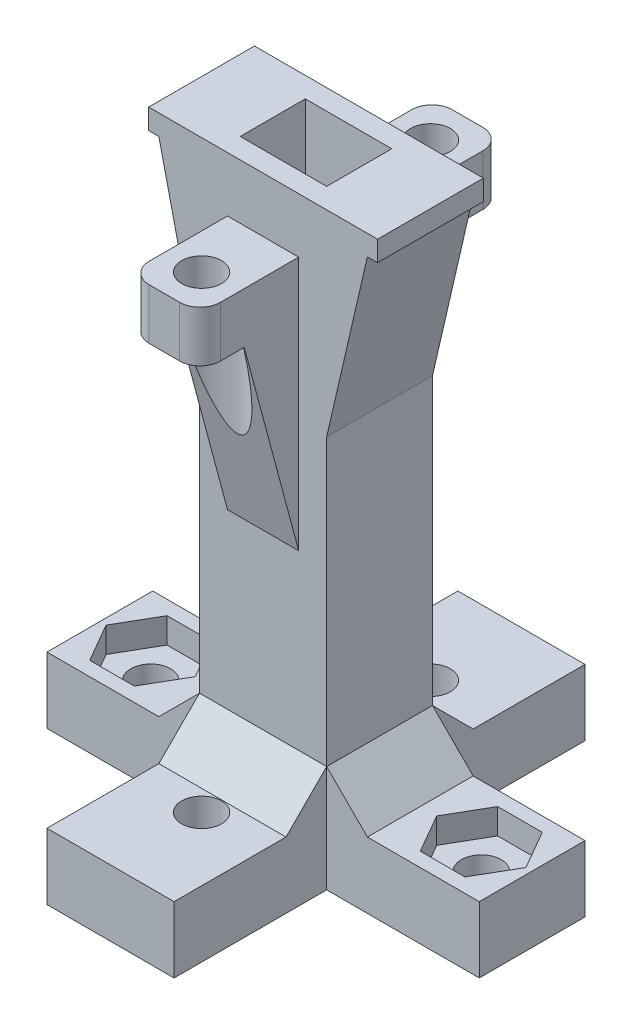
from build123d import *
from OCP.BRepFilletAPI import BRepFilletAPI_MakeChamfer

# Parameters (mm, degrees)
SKETCH1_W           = 15.875
SKETCH1_H           = 13.208
BOSS_EXTRUDE1_DEPTH = 73.533
SHELL1_T            = -2.54
SKETCH3_W           = 8.89
SKETCH3_H           = 6.35
BOSS_EXTRUDE2_DEPTH = 12.319
SKETCH4_W           = 8.89
SKETCH4_H           = 6.35
BOSS_EXTRUDE3_DEPTH = 12.319
SKETCH5_W           = 13.208
SKETCH5_H           = 8.255
BOSS_EXTRUDE4_DEPTH = 19.05
SKETCH6_W           = 15.875
SKETCH6_H           = 8.255
BOSS_EXTRUDE5_DEPTH = 19.05
SKETCH7_W           = 13.208
SKETCH7_H           = 8.255
BOSS_EXTRUDE6_DEPTH = 19.05
SKETCH8_W           = 15.875
SKETCH8_H           = 8.255
BOSS_EXTRUDE7_DEPTH = 19.05
SKETCH9_R           = 2.4892
CUT_EXTRUDE1_DEPTH  = 83.847766424
CUT_EXTRUDE2_REACH  = 84.848
SKETCH11_R          = 2.4892
FILLET3_R           = 2.54
CHAMFER2_SIZE       = 25.4
CHAMFER2_SIZE_2     = 6.805909488
SKETCH12_R          = 4.445
CUT_EXTRUDE3_DEPTH  = 52.07
SKETCH13_W          = 28.575
SKETCH13_H          = 13.208
SKETCH13_W_2        = 10.795
SKETCH13_H_2        = 8.128
BOSS_EXTRUDE8_DEPTH = 2.54
CHAMFER3_SIZE       = 5.08
CHAMFER3_SIZE2      = 22.003897441
CHAMFER4_SIZE       = 5.08
CHAMFER5_SIZE       = 5.08
CUT_EXTRUDE4_DEPTH  = 3.175
CUT_EXTRUDE5_DEPTH  = 3.175


# Some blends are built 0.0001 mm under size
with BuildPart() as part:
    # Sketch1 → Boss-Extrude1 (new body)
    with BuildSketch(Plane(origin=(0, 0, 0), x_dir=(1, 0, 0), z_dir=(0, 1, 0))):
        with Locations((0, 1.3335)):
            Rectangle(SKETCH1_W, SKETCH1_H)
    extrude(amount=BOSS_EXTRUDE1_DEPTH)

    # Shell1
    shell1_openings = [part.faces().sort_by_distance(p)[0] for p in [
        (0, 73.533, -1.3335),
        (0, 0, -1.3335),
    ]]
    offset(amount=SHELL1_T, openings=shell1_openings, kind=Kind.INTERSECTION)

    # Sketch3 → Boss-Extrude2 (add)
    with BuildSketch(Plane(origin=(0, 0, -7.9375), x_dir=(-1, 0, 0), z_dir=(0, 0, -1))):
        with Locations((0, 63.5)):
            Rectangle(SKETCH3_W, SKETCH3_H)
    extrude(amount=BOSS_EXTRUDE2_DEPTH)

    # Sketch4 → Boss-Extrude3 (add)
    with BuildSketch(Plane.XY.offset(5.2705)):
        with Locations((0, 63.5)):
            Rectangle(SKETCH4_W, SKETCH4_H)
    extrude(amount=BOSS_EXTRUDE3_DEPTH)

    # Sketch5 → Boss-Extrude4 (add)
    with BuildSketch(Plane.ZY.offset(7.9375)):
        with Locations((-1.3335, 4.1275)):
            Rectangle(SKETCH5_W, SKETCH5_H)
    extrude(amount=BOSS_EXTRUDE4_DEPTH)

    # Sketch6 → Boss-Extrude5 (add)
    with BuildSketch(Plane(origin=(0, 0, -7.9375), x_dir=(-1, 0, 0), z_dir=(0, 0, -1))):
        with Locations((0, 4.1275)):
            Rectangle(SKETCH6_W, SKETCH6_H)
    extrude(amount=BOSS_EXTRUDE5_DEPTH)

    # Sketch7 → Boss-Extrude6 (add)
    with BuildSketch(Plane(origin=(7.9375, 0, 0), x_dir=(0, 0, -1), z_dir=(1, 0, 0))):
        with Locations((1.3335, 4.1275)):
            Rectangle(SKETCH7_W, SKETCH7_H)
    extrude(amount=BOSS_EXTRUDE6_DEPTH)

    # Sketch8 → Boss-Extrude7 (add)
    with BuildSketch(Plane.XY.offset(5.2705)):
        with Locations((0, 4.1275)):
            Rectangle(SKETCH8_W, SKETCH8_H)
    extrude(amount=BOSS_EXTRUDE7_DEPTH)

    # Sketch9 → Cut-Extrude1 (cut, through all)
    with BuildSketch(Plane(origin=(0, 73.533, 0), x_dir=(1, 0, 0), z_dir=(0, 1, 0))):
        with Locations((0, 15.621)):
            Circle(SKETCH9_R)
        with Locations((0, -12.954)):
            Circle(SKETCH9_R)
    extrude(amount=-CUT_EXTRUDE1_DEPTH, mode=Mode.SUBTRACT)

    # Sketch11 → Cut-Extrude2 (cut, up to next)
    with BuildSketch(Plane(origin=(0, 0, 0), x_dir=(-1, 0, 0), z_dir=(0, -1, 0)), mode=Mode.PRIVATE) as cut_extrude2_sk1:
        with Locations(Location((20.6375, 1.3335, 0), (0, 0, 90))):
            Circle(SKETCH11_R)
    cut_extrude2_tool1 = extrude(cut_extrude2_sk1.sketch, amount=-CUT_EXTRUDE2_REACH, mode=Mode.PRIVATE) & part.part
    # Sketch11 → Cut-Extrude2 (cut, up to next)
    with BuildSketch(Plane(origin=(0, 0, 0), x_dir=(-1, 0, 0), z_dir=(0, -1, 0)), mode=Mode.PRIVATE) as cut_extrude2_sk2:
        with Locations(Location((-20.6375, 1.3335, 0), (0, 0, 90))):
            Circle(SKETCH11_R)
    cut_extrude2_tool2 = extrude(cut_extrude2_sk2.sketch, amount=-CUT_EXTRUDE2_REACH, mode=Mode.PRIVATE) & part.part
    add(cut_extrude2_tool1.solids().sort_by_distance((-20.6375, 0, -1.3335))[0], mode=Mode.SUBTRACT)
    add(cut_extrude2_tool2.solids().sort_by_distance((20.6375, 0, -1.3335))[0], mode=Mode.SUBTRACT)

    # Fillet3
    fillet3_edges = [part.edges().sort_by_distance(p)[0] for p in [
        (4.445, 63.5, -20.2565),
        (-4.445, 63.5, -20.2565),
        (4.445, 63.5, 17.5895),
        (-4.445, 63.5, 17.5895),
    ]]
    fillet(fillet3_edges, radius=FILLET3_R)

    # Chamfer2
    # the kernel refuses this chamfer: 25.4, 6.805909488 mm, written as the material it adds along each edge
    with BuildSketch(Plane(origin=(-4.445, 60.325, -7.9375), x_dir=(0, -0.9999503267608393, 0.00996714657715642), z_dir=(1, 0, 0))) as chamfer2_piece_1_section:
        Polygon((CHAMFER2_SIZE * 0.999950326761, CHAMFER2_SIZE * 0.00996714657716), (-CHAMFER2_SIZE_2 * 0.00996714657679, CHAMFER2_SIZE_2 * 0.999950326724), (0, 0), align=None)
    chamfer2_piece_1 = extrude(amount=8.89, mode=Mode.PRIVATE)
    chamfer2_piece_1 = chamfer2_piece_1 - Plane(origin=(0, 51.301210878, -15.621), x_dir=(1, 0, 0), z_dir=(0, 1, 0)) * Cylinder(2.4892, 120, mode=Mode.PRIVATE)
    add(chamfer2_piece_1)
    with BuildSketch(Plane(origin=(4.445, 60.325, 5.2705), x_dir=(0, -0.9999503267608393, -0.00996714657715642), z_dir=(-1, 0, 0))) as chamfer2_piece_2_section:
        Polygon((CHAMFER2_SIZE * 0.999950326761, CHAMFER2_SIZE * 0.00996714657716), (-CHAMFER2_SIZE_2 * 0.00996714657679, CHAMFER2_SIZE_2 * 0.999950326724), (0, 0), align=None)
    chamfer2_piece_2 = extrude(amount=8.89, mode=Mode.PRIVATE)
    chamfer2_piece_2 = chamfer2_piece_2 - Plane(origin=(0, 51.301210878, 12.954), x_dir=(1, 0, 0), z_dir=(0, 1, 0)) * Cylinder(2.4892, 120, mode=Mode.PRIVATE)
    add(chamfer2_piece_2)

    # Sketch12 → Cut-Extrude3 (cut)
    with BuildSketch(Plane.XZ.offset(-60.325)):
        with Locations((0, -15.621)):
            Circle(SKETCH12_R)
        with Locations((0, 12.954)):
            Circle(SKETCH12_R)
    extrude(amount=CUT_EXTRUDE3_DEPTH, mode=Mode.SUBTRACT)

    # Sketch13 → Boss-Extrude8 (add)
    with BuildSketch(Plane(origin=(0, 73.533, 0), x_dir=(1, 0, 0), z_dir=(0, 1, 0))):
        with Locations((0, 1.3335)):
            Rectangle(SKETCH13_W, SKETCH13_H)
        with Locations((0, 1.3335)):
            Rectangle(SKETCH13_W_2, SKETCH13_H_2, mode=Mode.SUBTRACT)
    extrude(amount=-BOSS_EXTRUDE8_DEPTH)

    # Chamfer3: one chamfer whose edges measure the first distance from different faces: ONE call of the kernel's chamfer builder (chamfer() names one face for all edges)
    chamfer3_edges_1 = [part.edges().sort_by_distance(p)[0] for p in [
        (7.9375, 70.993, -1.3335),
    ]]
    chamfer3_side_1 = [part.faces().sort_by_distance(p)[0] for p in [
        (11.1125, 70.993, -1.3335),
    ]]
    chamfer3_edges_2 = [part.edges().sort_by_distance(p)[0] for p in [
        (-7.9375, 70.993, -1.3335),
    ]]
    chamfer3_side_2 = [part.faces().sort_by_distance(p)[0] for p in [
        (-11.1125, 70.993, -1.3335),
    ]]
    chamfer3 = BRepFilletAPI_MakeChamfer(part.part.solid().wrapped)
    for e in chamfer3_edges_1:
        chamfer3.Add(CHAMFER3_SIZE, CHAMFER3_SIZE2, e.wrapped, chamfer3_side_1[0].wrapped)  # the first distance lies on this face
    for e in chamfer3_edges_2:
        chamfer3.Add(CHAMFER3_SIZE, CHAMFER3_SIZE2, e.wrapped, chamfer3_side_2[0].wrapped)  # the first distance lies on this face
    add(Compound.cast(chamfer3.Shape()), mode=Mode.REPLACE)

    # Chamfer4
    # the kernel refuses this chamfer: 5.08 mm, written as the material it adds along each edge
    with BuildSketch(Plane(origin=(-7.9375, 8.255, -7.9375), x_dir=(0, 0.9996219169112968, 0.027495876610586438), z_dir=(1, 0, 0)), Plane(origin=(7.9375, 8.255, 5.2705), x_dir=(0, 0.9996219169112968, -0.027495876610586438), z_dir=(-1, 0, 0))) as chamfer4_piece_1:
        Polygon((CHAMFER4_SIZE * 0.999621916911, -CHAMFER4_SIZE * 0.0274958766106), (-CHAMFER4_SIZE * 0.0274958766106, -CHAMFER4_SIZE * 0.999621916911), (0, 0), align=None)
    extrude(amount=15.875)

    # Chamfer5
    chamfer5_edges = [part.edges().sort_by_distance(p)[0] for p in [
        (-7.9375, 8.255, -1.3335),
        (7.9375, 8.255, -1.3335),
    ]]
    chamfer(chamfer5_edges, length=CHAMFER5_SIZE - 0.0001)  # a hair under: the kernel refuses the full size

    # Sketch14 → Cut-Extrude4 (cut)
    with BuildSketch(Plane(origin=(0, 8.255, 0), x_dir=(1, 0, 0), z_dir=(0, 1, 0))):
        Polygon((-26.210084798, 1.3335), (-23.423792399, -3.4925), (-17.851207601, -3.4925), (-15.064915202, 1.3335), (-17.851207601, 6.1595), (-23.423792399, 6.1595), align=None)
    extrude(amount=-CUT_EXTRUDE4_DEPTH, mode=Mode.SUBTRACT)

    # Sketch15 → Cut-Extrude5 (cut)
    with BuildSketch(Plane(origin=(0, 8.255, 0), x_dir=(1, 0, 0), z_dir=(0, 1, 0))):
        Polygon((15.064915202, 1.3335), (17.851207601, -3.4925), (23.423792399, -3.4925), (26.210084798, 1.3335), (23.423792399, 6.1595), (17.851207601, 6.1595), align=None)
    extrude(amount=-CUT_EXTRUDE5_DEPTH, mode=Mode.SUBTRACT)


solid = part.part
